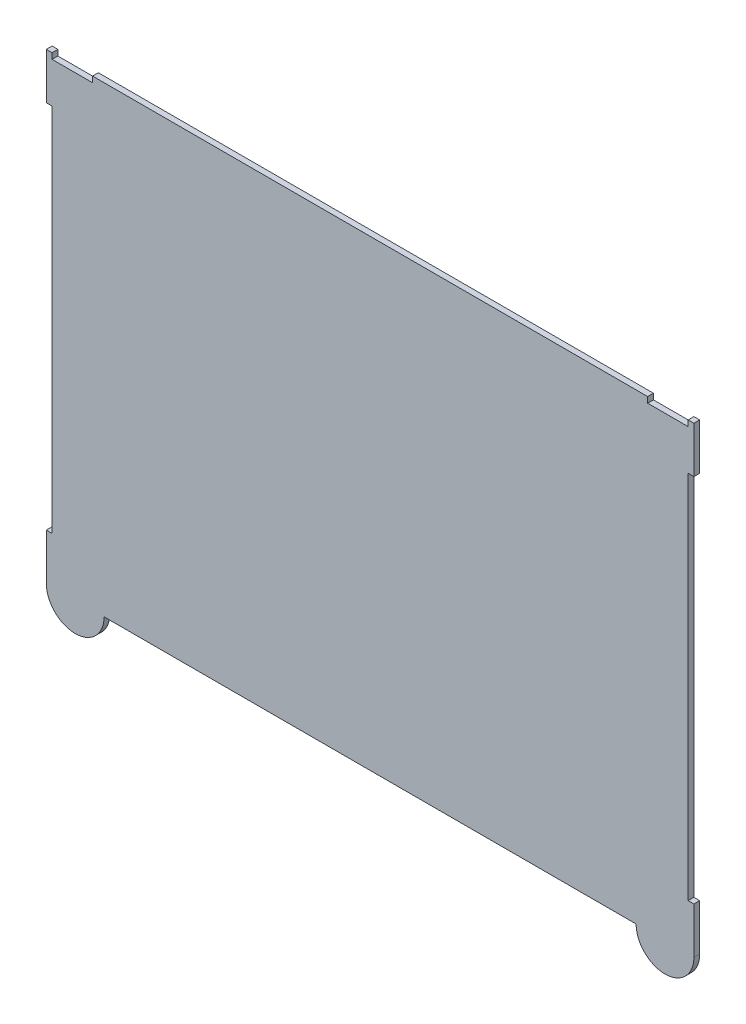
from build123d import *

# Parameters (mm, degrees)
BOSS_EXTRUDE1_DEPTH = 3.175


with BuildPart() as part:
    # Sketch1 → Boss-Extrude1 (new body)
    with BuildSketch(Plane.XY):
        with BuildLine():
            Line((0, 228.6), (0, 250.825))
            Line((0, 250.825), (0, 254))
            Line((0, 254), (3.175, 254))
            Line((3.175, 254), (3.175, 250.825))
            Line((3.175, 250.825), (25.4, 250.825))
            Line((25.4, 250.825), (25.4, 254))
            Line((25.4, 254), (330.2, 254))
            Line((330.2, 254), (330.2, 250.825))
            Line((330.2, 250.825), (352.425, 250.825))
            Line((352.425, 250.825), (352.425, 254))
            Line((352.425, 254), (355.6, 254))
            Line((355.6, 254), (355.6, 250.825))
            Line((355.6, 250.825), (355.6, 228.6))
            Line((355.6, 228.6), (352.425, 228.6))
            Line((352.425, 228.6), (352.425, 25.4))
            Line((352.425, 25.4), (355.6, 25.4))
            Line((355.6, 25.4), (355.6, 0))
            ThreePointArc((355.6, 0), (339.725, -15.875), (323.85, 0))
            Line((323.85, 0), (31.75, 0))
            ThreePointArc((31.75, 0), (15.875, -15.875), (0, 0))
            Line((0, 0), (0, 25.4))
            Line((0, 25.4), (3.175, 25.4))
            Line((3.175, 25.4), (3.175, 228.6))
            Line((3.175, 228.6), (0, 228.6))
        make_face()
    extrude(amount=BOSS_EXTRUDE1_DEPTH)


solid = part.part
